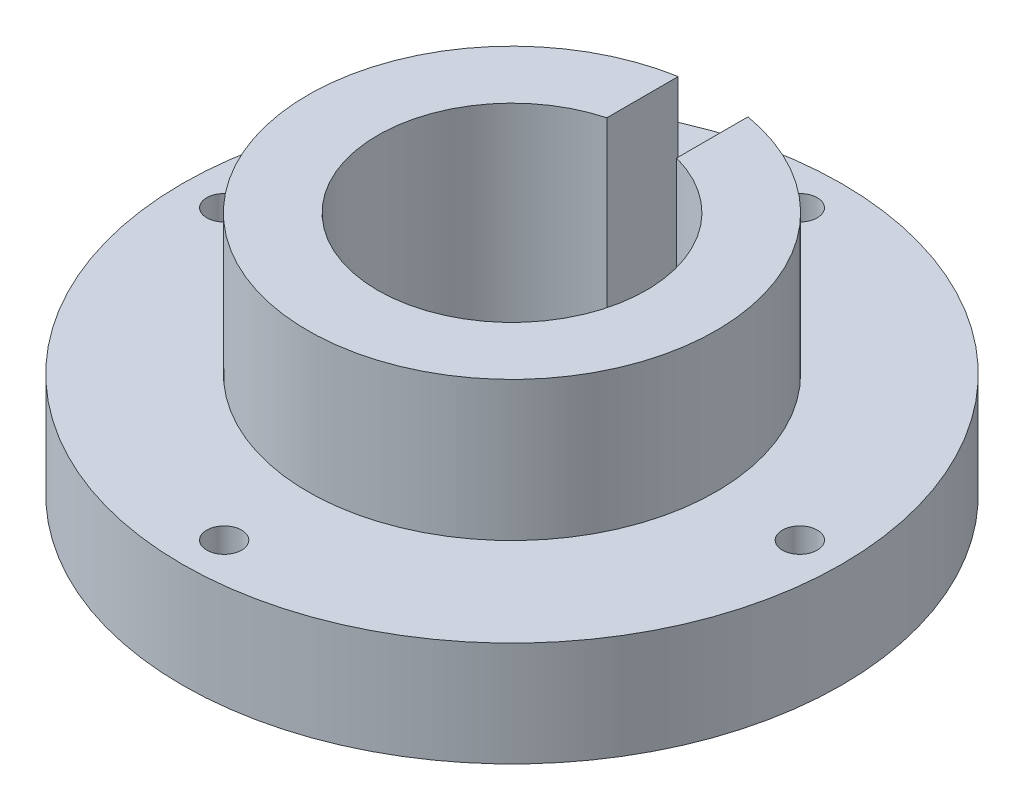
from build123d import *

# Parameters (mm, degrees)
SKETCH1_R           = 47.25
SKETCH1_R_2         = 2.5
BOSS_EXTRUDE1_DEPTH = 15
BOSS_EXTRUDE2_DEPTH = 20


with BuildPart() as part:
    # Sketch1 → Boss-Extrude1 (new body)
    with BuildSketch(Plane(origin=(0, 0, 0), x_dir=(1, 0, 0), z_dir=(0, 1, 0))):
        Circle(SKETCH1_R)
        with Locations((0, 41.25)):
            Circle(SKETCH1_R_2, mode=Mode.SUBTRACT)
        with Locations((41.25, 0)):
            Circle(SKETCH1_R_2, mode=Mode.SUBTRACT)
        with Locations((0, -41.25)):
            Circle(SKETCH1_R_2, mode=Mode.SUBTRACT)
        with Locations((-41.25, 0)):
            Circle(SKETCH1_R_2, mode=Mode.SUBTRACT)
        with BuildLine():
            Line((-5, 18.589311445), (-5, 29.25))
            Line((-5, 29.25), (5, 29.25))
            Line((5, 29.25), (5, 18.589311445))
            ThreePointArc((5, 18.589311445), (0, -19.25), (-5, 18.589311445))
        make_face(mode=Mode.SUBTRACT)
    extrude(amount=BOSS_EXTRUDE1_DEPTH)

    # Sketch2 → Boss-Extrude2 (add)
    with BuildSketch(Plane(origin=(0, 15, 0), x_dir=(1, 0, 0), z_dir=(0, 1, 0))):
        with BuildLine():
            Line((5, 18.589311445), (5, 28.819481258))
            ThreePointArc((5, 28.819481258), (0, -29.25), (-5, 28.819481258))
            Line((-5, 28.819481258), (-5, 18.589311445))
            ThreePointArc((-5, 18.589311445), (0, -19.25), (5, 18.589311445))
        make_face()
    extrude(amount=BOSS_EXTRUDE2_DEPTH)


solid = part.part
